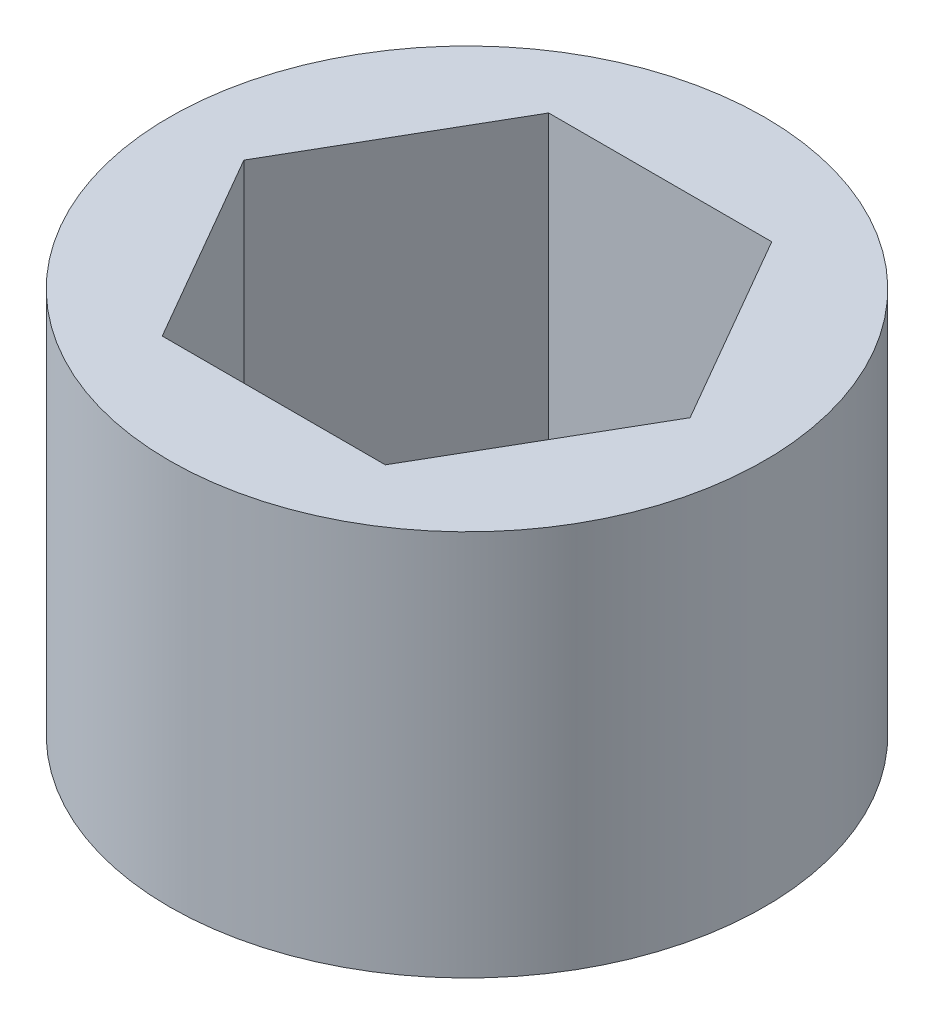
from build123d import *

# Parameters (mm, degrees)
SKETCH1_R           = 9.779
BOSS_EXTRUDE1_DEPTH = 6.35


with BuildPart() as part:
    # Sketch1 → Boss-Extrude1 (new, symmetric)
    with BuildSketch(Plane(origin=(0, 0, 0), x_dir=(1, 0, 0), z_dir=(0, 1, 0))):
        Circle(SKETCH1_R)
        Polygon((-3.666174209, 6.35), (-7.332348419, 0), (-3.666174209, -6.35), (3.666174209, -6.35), (7.332348419, 0), (3.666174209, 6.35), align=None, mode=Mode.SUBTRACT)
    extrude(amount=BOSS_EXTRUDE1_DEPTH, both=True)


solid = part.part
